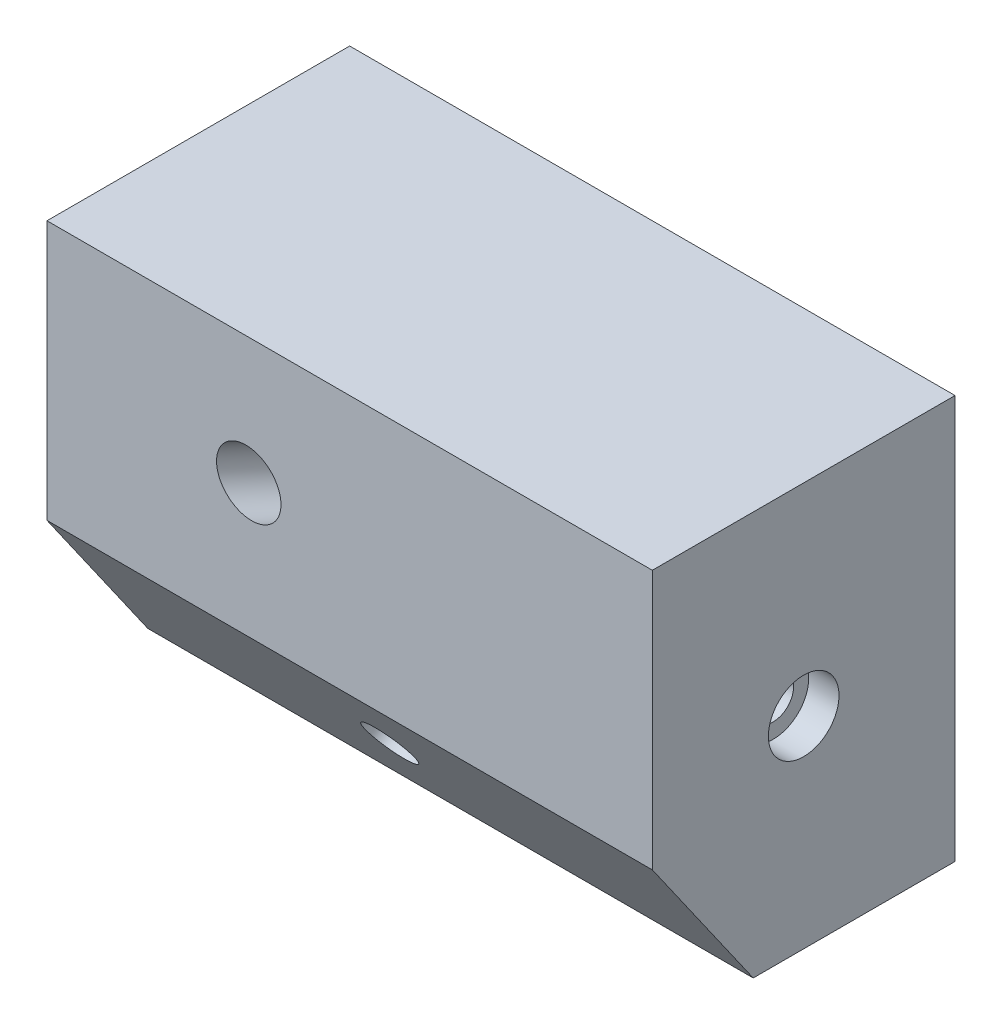
from build123d import *

# Parameters (mm, degrees)
SKETCH_1_W          = 120
SKETCH_1_H          = 80
EXTRUDE_1_DEPTH     = 60
CUT_EXTRUDE_1_DEPTH = 121
SKETCH_5_R          = 7
CUT_EXTRUDE_2_DEPTH = 6
SKETCH_6_R          = 4
CUT_EXTRUDE_3_DEPTH = 50
SWEEP_START         = -57.550317598
SWEEP_6_OUTLINE_R   = 6
SWEEP_6_DEPTH       = 59.776219427
SWEEP_10_PROFILE_R  = 5


# Read off the part's stored shape, not the designer's step: 切除-扫描6
with BuildPart() as part:
    # 草图1 → 凸台-拉伸1 (new body)
    with BuildSketch(Plane.XY):
        with Locations((60, 40)):
            Rectangle(SKETCH_1_W, SKETCH_1_H)
    extrude(amount=EXTRUDE_1_DEPTH)

    # 草图2 → 切除-拉伸1 (cut, symmetric)
    with BuildSketch(Plane(origin=(60, 0, 0), x_dir=(0, 0, -1), z_dir=(1, 0, 0))):
        Polygon((-40, 0), (-60, 0), (-60, 28.5629), align=None)
    extrude(amount=CUT_EXTRUDE_1_DEPTH, both=True, mode=Mode.SUBTRACT)

    # 草图5 → 切除-拉伸2 (cut)
    with BuildSketch(Plane(origin=(120, 0, 0), x_dir=(0, 0, -1), z_dir=(1, 0, 0))):
        with Locations((-30, 40)):
            Circle(SKETCH_5_R)
    extrude(amount=-CUT_EXTRUDE_2_DEPTH, mode=Mode.SUBTRACT)

    # 草图6 → 切除-拉伸3 (cut)
    with BuildSketch(Plane(origin=(120, 0, 0), x_dir=(0, 0, -1), z_dir=(1, 0, 0))):
        with Locations((-30, 40)):
            Circle(SKETCH_6_R)
    extrude(amount=-CUT_EXTRUDE_3_DEPTH, mode=Mode.SUBTRACT)

    # 切除-扫描6 outline → 切除-扫描6 (cut)
    with BuildSketch(Plane(origin=(0, 0, 0), x_dir=(0.9433989278967365, 0.08584365654425449, 0.3203581269054996), z_dir=(0.331660161676509, -0.244180106351077, -0.911250576306588)).offset(SWEEP_START)):
        with Locations((61.67884584, -37.595946176)):
            Circle(SWEEP_6_OUTLINE_R)
    extrude(amount=SWEEP_6_DEPTH, mode=Mode.SUBTRACT)

    # 切除-扫描10: sweep along a curve in space
    with BuildLine() as sweep_10_path:
        Line((57.94, 13.134, 51.638), (57.94, 41.793, 10.709))
    # 切除-扫描10 profile (on start of the path) → 切除-扫描10 (sweep, cut)
    with BuildSketch(Plane(origin=(57.94, 13.134, 51.638), x_dir=(0, -0.8191501102855187, -0.5735791983843407), z_dir=(0, 0.5735791983843407, -0.8191501102855187))):
        Circle(SWEEP_10_PROFILE_R)
    sweep(path=sweep_10_path.line, mode=Mode.SUBTRACT)

    # 草图41 → 切除-放样5 section 0
    with BuildSketch(Plane.XY.offset(8), mode=Mode.PRIVATE) as loft_5_s0:
        with BuildLine():
            Line((64.227, 37.163), (65.185, 39.309))
            Line((65.185, 39.309), (65.19, 41.722))
            Line((65.19, 41.722), (64.24, 44.036))
            Line((64.24, 44.036), (62.483, 45.897))
            Line((62.483, 45.897), (60.183, 47.023))
            Line((60.183, 47.023), (57.692, 47.242))
            Line((57.692, 47.242), (55.389, 46.52))
            Line((55.389, 46.52), (53.625, 44.969))
            Line((53.625, 44.969), (52.667, 42.823))
            Line((52.667, 42.823), (52.662, 40.41))
            Line((52.662, 40.41), (53.612, 38.096))
            Line((53.612, 38.096), (55.37, 36.235))
            Line((55.37, 36.235), (57.669, 35.109))
            Line((57.669, 35.109), (60.16, 34.89))
            Line((60.16, 34.89), (62.463, 35.612))
            Line((62.463, 35.612), (64.227, 37.163))
        make_face()
    loft([loft_5_s0.sketch, Vertex(60.122, 40.186, 4.715)], mode=Mode.SUBTRACT)


solid = part.part
